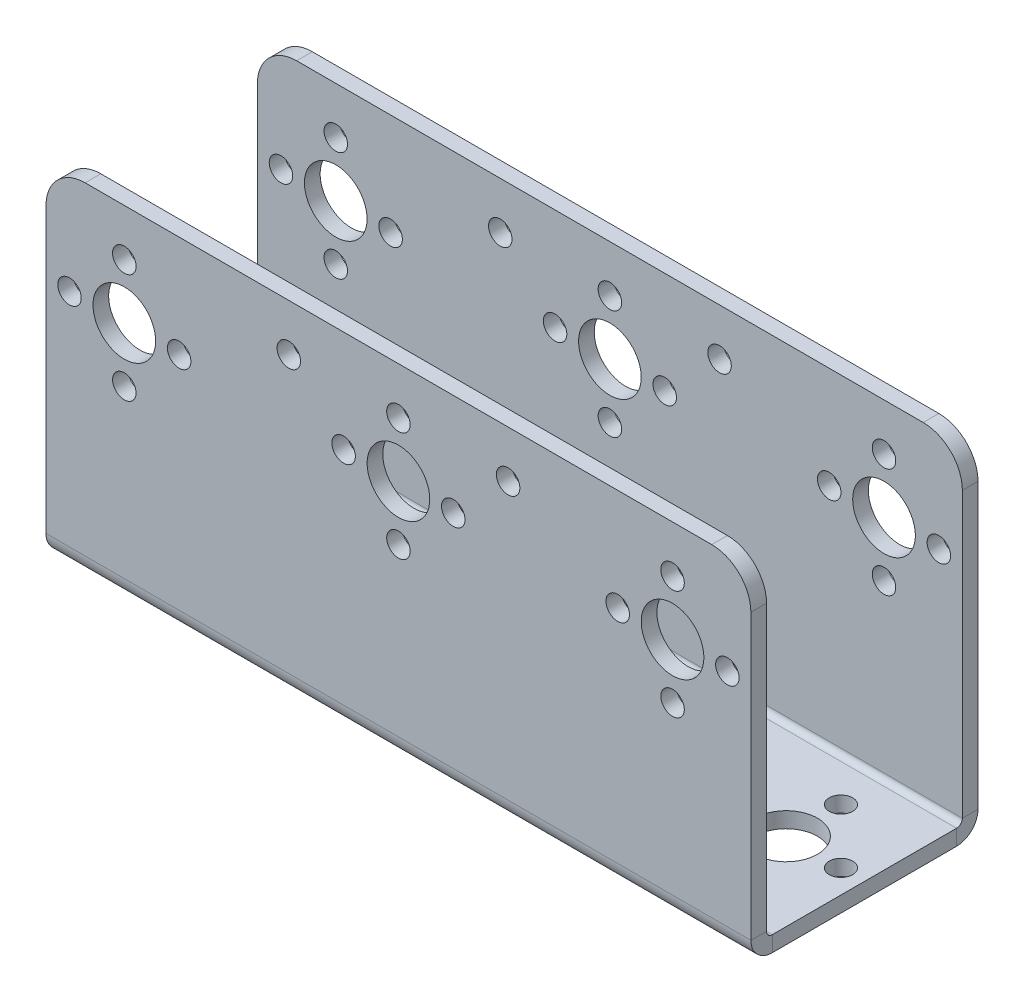
from build123d import *

# Parameters (mm, degrees)
SKETCH_1_W                         = 90
SKETCH_1_H                         = 29
SKETCH_1_R                         = 4
SKETCH_1_R_2                       = 1.5
SM_BASE_FLANGE_1_DEPTH             = 2
SM_EDGE_FLANGE_1_STRIP_W           = 9.4732
SM_EDGE_FLANGE_1_STRIP_H           = 2
SM_EDGE_FLANGE_1_STRIP_CUT_DEPTH   = 90
SM_EDGE_FLANGE_1_STRIP_2_W         = 9.4732
SM_EDGE_FLANGE_1_STRIP_2_H         = 2
SM_EDGE_FLANGE_1_STRIP_CUT_2_DEPTH = 90
SM_EDGE_FLANGE_1_DEPTH             = 90
SM_EDGE_FLANGE_1_BEND_DEPTH        = 90
SKETCH_12_R                        = 4
SKETCH_12_R_2                      = 1.5
CUT_EXTRUDE_1_DEPTH                = 55
FILLET_1_R                         = 5


# Sheet-metal steps are written as plain solids
with BuildPart() as part:
    # Sketch 1 → 基体-法兰1 (new body)
    with BuildSketch(Plane(origin=(0, 0, 0), x_dir=(1, 0, 0), z_dir=(0, 1, 0))):
        with Locations((45, -14.5)):
            Rectangle(SKETCH_1_W, SKETCH_1_H)
        with Locations(Location((45, -14.5, 0), (0, 0, 270))):
            Circle(SKETCH_1_R, mode=Mode.SUBTRACT)
        with Locations(Location((10, -14.5, 0), (0, 0, 270))):
            Circle(SKETCH_1_R, mode=Mode.SUBTRACT)
        with Locations(Location((80, -14.5, 0), (0, 0, 270))):
            Circle(SKETCH_1_R, mode=Mode.SUBTRACT)
        with Locations(Location((10, -7.5, 0), (0, 0, 270))):
            Circle(SKETCH_1_R_2, mode=Mode.SUBTRACT)
        with Locations(Location((10, -21.5, 0), (0, 0, 270))):
            Circle(SKETCH_1_R_2, mode=Mode.SUBTRACT)
        with Locations(Location((17, -14.5, 0), (0, 0, 270))):
            Circle(SKETCH_1_R_2, mode=Mode.SUBTRACT)
        with Locations(Location((3, -14.5, 0), (0, 0, 270))):
            Circle(SKETCH_1_R_2, mode=Mode.SUBTRACT)
        with Locations(Location((45, -7.5, 0), (0, 0, 270))):
            Circle(SKETCH_1_R_2, mode=Mode.SUBTRACT)
        with Locations(Location((45, -21.5, 0), (0, 0, 270))):
            Circle(SKETCH_1_R_2, mode=Mode.SUBTRACT)
        with Locations(Location((52, -14.5, 0), (0, 0, 270))):
            Circle(SKETCH_1_R_2, mode=Mode.SUBTRACT)
        with Locations(Location((38, -14.5, 0), (0, 0, 270))):
            Circle(SKETCH_1_R_2, mode=Mode.SUBTRACT)
        with Locations(Location((87, -14.5, 0), (0, 0, 90))):
            Circle(SKETCH_1_R_2, mode=Mode.SUBTRACT)
        with Locations(Location((80, -21.5, 0), (0, 0, 90))):
            Circle(SKETCH_1_R_2, mode=Mode.SUBTRACT)
        with Locations(Location((73, -14.5, 0), (0, 0, 90))):
            Circle(SKETCH_1_R_2, mode=Mode.SUBTRACT)
        with Locations(Location((80, -7.5, 0), (0, 0, 90))):
            Circle(SKETCH_1_R_2, mode=Mode.SUBTRACT)
    extrude(amount=-SM_BASE_FLANGE_1_DEPTH)

    # 边线-法兰1 strip (across the edge) → 边线-法兰1 strip cut (cut)
    with BuildSketch(Plane.ZY.offset(-90)):
        with Locations((-2, -1)):
            Rectangle(SM_EDGE_FLANGE_1_STRIP_W, SM_EDGE_FLANGE_1_STRIP_H)
    extrude(amount=SM_EDGE_FLANGE_1_STRIP_CUT_DEPTH, mode=Mode.SUBTRACT)

    # 边线-法兰1 strip 2 (across the edge) → 边线-法兰1 strip cut 2 (cut)
    with BuildSketch(Plane(origin=(0, 0, 29), x_dir=(0, 0, -1), z_dir=(1, 0, 0))):
        with Locations((-2, -1)):
            Rectangle(SM_EDGE_FLANGE_1_STRIP_2_W, SM_EDGE_FLANGE_1_STRIP_2_H)
    extrude(amount=SM_EDGE_FLANGE_1_STRIP_CUT_2_DEPTH, mode=Mode.SUBTRACT)

    # 边线-法兰1 section (across the edge) → 边线-法兰1 (add)
    with BuildSketch(Plane.ZY.offset(-90)):
        with BuildLine():
            Line((0, 0.7366), (0, 42))
            Line((0, 42), (2, 42))
            Line((2, 42), (2, 0.7366))
            ThreePointArc((2, 0.7366), (2.215745145, 0.215745145), (2.7366, 0))
            Line((2.7366, 0), (2.7366, -2))
            ThreePointArc((2.7366, -2), (0.801531583, -1.198468417), (0, 0.7366))
        make_face()
    extrude(amount=SM_EDGE_FLANGE_1_DEPTH)

    # 边线-法兰1 section 2 (across the edge) → 边线-法兰1 bend (add)
    with BuildSketch(Plane(origin=(0, 0, 29), x_dir=(0, 0, -1), z_dir=(1, 0, 0))):
        with BuildLine():
            Line((0, 0.7366), (0, 42))
            Line((0, 42), (2, 42))
            Line((2, 42), (2, 0.7366))
            ThreePointArc((2, 0.7366), (2.215745145, 0.215745145), (2.7366, 0))
            Line((2.7366, 0), (2.7366, -2))
            ThreePointArc((2.7366, -2), (0.801531583, -1.198468417), (0, 0.7366))
        make_face()
    extrude(amount=SM_EDGE_FLANGE_1_BEND_DEPTH)

    # 草图12 → 切除-拉伸1 (cut)
    with BuildSketch(Plane.XY.offset(29)):
        with Locations((45, 29)):
            Circle(SKETCH_12_R)
        with Locations((80, 29)):
            Circle(SKETCH_12_R)
        with Locations((10, 29)):
            Circle(SKETCH_12_R)
        with Locations((10, 36)):
            Circle(SKETCH_12_R_2)
        with Locations((10, 22)):
            Circle(SKETCH_12_R_2)
        with Locations((17, 29)):
            Circle(SKETCH_12_R_2)
        with Locations((3, 29)):
            Circle(SKETCH_12_R_2)
        with Locations((45, 36)):
            Circle(SKETCH_12_R_2)
        with Locations((45, 22)):
            Circle(SKETCH_12_R_2)
        with Locations((52, 29)):
            Circle(SKETCH_12_R_2)
        with Locations((38, 29)):
            Circle(SKETCH_12_R_2)
        with Locations(Location((87, 29, 0), (0, 0, 90))):
            Circle(SKETCH_12_R_2)
        with Locations(Location((80, 36, 0), (0, 0, 90))):
            Circle(SKETCH_12_R_2)
        with Locations(Location((73, 29, 0), (0, 0, 90))):
            Circle(SKETCH_12_R_2)
        with Locations(Location((80, 22, 0), (0, 0, 90))):
            Circle(SKETCH_12_R_2)
        with Locations((31, 36)):
            Circle(SKETCH_12_R_2)
        with Locations((59, 36)):
            Circle(SKETCH_12_R_2)
    extrude(amount=-CUT_EXTRUDE_1_DEPTH, mode=Mode.SUBTRACT)

    # 圆角1
    fillet_1_edges = [part.edges().sort_by_distance(p)[0] for p in [
        (90, 42, 1),
        (0, 42, 1),
        (0, 42, 28),
        (90, 42, 28),
    ]]
    fillet(fillet_1_edges, radius=FILLET_1_R)


solid = part.part
